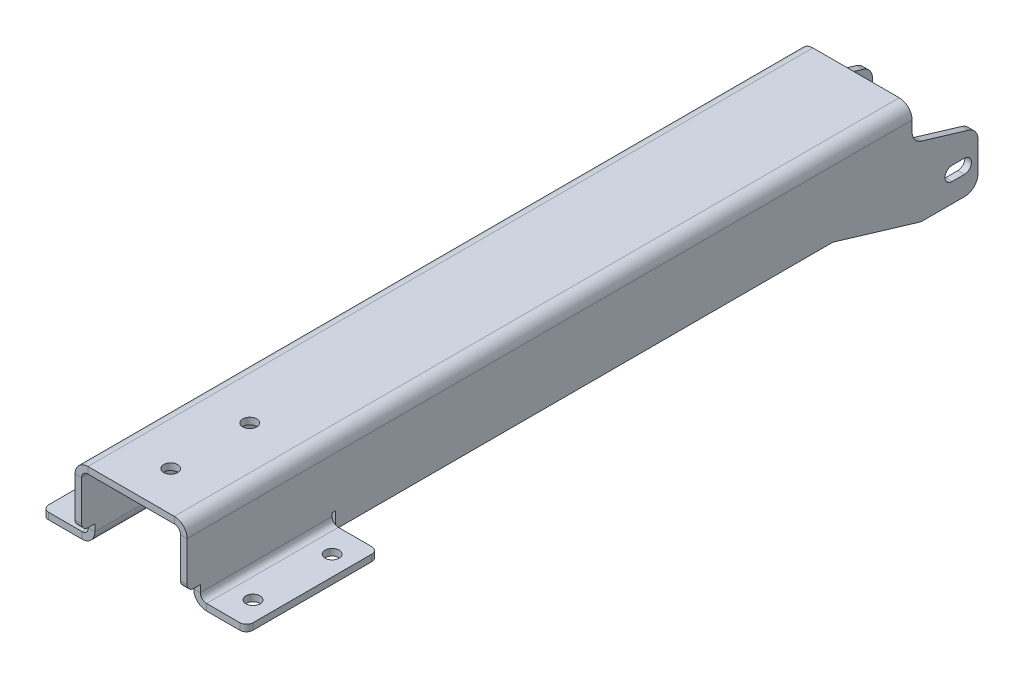
from build123d import *

# Parameters (mm, degrees)
SKETCH1_W                            = 47.625
SKETCH1_H                            = 352.425
BASE_FLANGE1_DEPTH                   = 3.175
EDGE_FLANGE1_STRIP_W                 = 18.7
EDGE_FLANGE1_STRIP_H                 = 3.175
EDGE_FLANGE1_STRIP_CUT_DEPTH         = 352.425
EDGE_FLANGE1_DEPTH                   = 352.425
EDGE_FLANGE2_STRIP_W                 = 18.7
EDGE_FLANGE2_STRIP_H                 = 3.175
EDGE_FLANGE2_STRIP_CUT_DEPTH         = 352.425
EDGE_FLANGE2_DEPTH                   = 352.425
BOSS_EXTRUDE1_DEPTH                  = 3.175
BOSS_EXTRUDE2_DEPTH                  = 3.175
F_17_64_START                        = -3.175
F_17_64_0_26563_DIAMETER_SLOT1_DEPTH = 53.975
F_17_64_0_26563_DIAMETER_HOLE2_D     = 6.747002
SKETCH21_W                           = 9.525
SKETCH21_H                           = 9.525
CUT_EXTRUDE1_DEPTH                   = 392.259979106
EDGE_FLANGE5_STRIP_W                 = 18.7
EDGE_FLANGE5_STRIP_H                 = 3.175
EDGE_FLANGE5_STRIP_CUT_DEPTH         = 63.5
EDGE_FLANGE5_RELIEF_W                = 20.2875
EDGE_FLANGE5_RELIEF_H                = 1.5875
EDGE_FLANGE5_RELIEF_CUT_DEPTH        = 3.175
EDGE_FLANGE5_DEPTH                   = 63.5
FILLET2_R                            = 6.35
F_17_64_0_26563_DIAMETER_HOLE3_D     = 6.747002
FILLET3_R                            = 3.175
CUT_EXTRUDE3_DEPTH                   = 395.939882292
CUT_EXTRUDE3_DEPTH_BACK              = 395.939882292
SKETCH30_W                           = 3.175
SKETCH30_H                           = 28.575
FILLET4_R                            = 3.175


# Read off the part's stored shape, not the designer's step: 17/64 (0.26563) Diameter Slot1
# Sheet-metal steps are written as plain solids
with BuildPart() as part:
    # Sketch1 → Base-Flange1 (new body)
    with BuildSketch(Plane(origin=(0, 0, 0), x_dir=(1, 0, 0), z_dir=(0, 1, 0))):
        with Locations((23.8125, 176.2125)):
            Rectangle(SKETCH1_W, SKETCH1_H)
    extrude(amount=-BASE_FLANGE1_DEPTH)

    # Edge-Flange1 strip (across the edge) → Edge-Flange1 strip cut (cut)
    with BuildSketch(Plane(origin=(47.625, -3.175, -352.425), x_dir=(-1, 0, 0), z_dir=(0, 0, 1))):
        with Locations((-6.35, -1.5875)):
            Rectangle(EDGE_FLANGE1_STRIP_W, EDGE_FLANGE1_STRIP_H)
    extrude(amount=EDGE_FLANGE1_STRIP_CUT_DEPTH, mode=Mode.SUBTRACT)

    # Edge-Flange1 section (across the edge) → Edge-Flange1 (add)
    with BuildSketch(Plane(origin=(47.625, -3.175, -352.425), x_dir=(-1, 0, 0), z_dir=(0, 0, 1))):
        with BuildLine():
            Line((-3.175, 3), (-3.175, 34.925))
            Line((-3.175, 34.925), (0, 34.925))
            Line((0, 34.925), (0, 3))
            ThreePointArc((0, 3), (0.878679656, 0.878679656), (3, 0))
            Line((3, 0), (3, -3.175))
            ThreePointArc((3, -3.175), (-1.366384374, -1.366384374), (-3.175, 3))
        make_face()
    extrude(amount=EDGE_FLANGE1_DEPTH)

    # Edge-Flange2 strip (across the edge) → Edge-Flange2 strip cut (cut)
    with BuildSketch(Plane(origin=(0, -3.175, 0), x_dir=(1, 0, 0), z_dir=(0, 0, -1))):
        with Locations((-6.35, -1.5875)):
            Rectangle(EDGE_FLANGE2_STRIP_W, EDGE_FLANGE2_STRIP_H)
    extrude(amount=EDGE_FLANGE2_STRIP_CUT_DEPTH, mode=Mode.SUBTRACT)

    # Edge-Flange2 section (across the edge) → Edge-Flange2 (add)
    with BuildSketch(Plane(origin=(0, -3.175, 0), x_dir=(1, 0, 0), z_dir=(0, 0, -1))):
        with BuildLine():
            Line((-3.175, 3), (-3.175, 34.925))
            Line((-3.175, 34.925), (0, 34.925))
            Line((0, 34.925), (0, 3))
            ThreePointArc((0, 3), (0.878679656, 0.878679656), (3, 0))
            Line((3, 0), (3, -3.175))
            ThreePointArc((3, -3.175), (-1.366384374, -1.366384374), (-3.175, 3))
        make_face()
    extrude(amount=EDGE_FLANGE2_DEPTH)

    # Sketch12 → Boss-Extrude1 (add)
    with BuildSketch(Plane.ZY.offset(3.175)):
        Polygon((-384.175, -50.8), (-384.175, -25.4), (-352.425, -15.875), (-352.425, -38.1), (-314.325, -38.1), (-356.658333333, -50.8), align=None)
    extrude(amount=-BOSS_EXTRUDE1_DEPTH)

    # Sketch13 → Boss-Extrude2 (add)
    with BuildSketch(Plane(origin=(50.8, 0, 0), x_dir=(0, 0, -1), z_dir=(1, 0, 0))):
        Polygon((352.425, -15.875), (352.425, -38.1), (314.325, -38.1), (356.658333333, -50.8), (384.175, -50.8), (384.175, -25.4), align=None)
    extrude(amount=-BOSS_EXTRUDE2_DEPTH)

    # 17/64 (0.26563) Diameter Slot1 outline → 17/64 (0.26563) Diameter Slot1 (cut)
    with BuildSketch(Plane.YZ.offset(F_17_64_START)):
        with BuildLine():
            ThreePointArc((-41.473501, -377.626499), (-38.1, -381), (-34.726499, -377.626499))
            Line((-34.726499, -377.626499), (-34.726499, -371.673501))
            ThreePointArc((-34.726499, -371.673501), (-38.1, -368.3), (-41.473501, -371.673501))
            Line((-41.473501, -371.673501), (-41.473501, -377.626499))
        make_face()
    extrude(amount=F_17_64_0_26563_DIAMETER_SLOT1_DEPTH, mode=Mode.SUBTRACT)

    # 17/64 (0.26563) Diameter Hole2 (through all)
    with Locations(Plane(origin=(0, 0, 0), x_dir=(1, 0, 0), z_dir=(0, 1, 0))):
        with Locations((23.8125, 22.225), (23.8125, 60.325)):
            Hole(F_17_64_0_26563_DIAMETER_HOLE2_D / 2)

    # Sketch21 → Cut-Extrude1 (cut, through all)
    with BuildSketch(Plane.ZY.offset(3.175)):
        with Locations((-4.7625, -33.3375)):
            Rectangle(SKETCH21_W, SKETCH21_H)
    extrude(amount=-CUT_EXTRUDE1_DEPTH, mode=Mode.SUBTRACT)

    # Edge-Flange5 strip (across the edge) → Edge-Flange5 strip cut (cut)
    with BuildSketch(Plane(origin=(-3.175, -38.1, -73.025), x_dir=(0, 1, 0), z_dir=(0, 0, 1))):
        with Locations((-3.175, -1.5875)):
            Rectangle(EDGE_FLANGE5_STRIP_W, EDGE_FLANGE5_STRIP_H)
    edge_flange5_strip_cut = extrude(amount=EDGE_FLANGE5_STRIP_CUT_DEPTH, mode=Mode.SUBTRACT)

    # Edge-Flange5 relief (on the sheet) → Edge-Flange5 relief cut (cut)
    with BuildSketch(Plane(origin=(-3.175, -31.925, -73.025), x_dir=(0, 1, 0), z_dir=(-1, 0, 0))):
        with Locations((-8.55625, 0.79375)):
            Rectangle(EDGE_FLANGE5_RELIEF_W, EDGE_FLANGE5_RELIEF_H)
    edge_flange5_relief_cut = extrude(amount=-EDGE_FLANGE5_RELIEF_CUT_DEPTH, mode=Mode.SUBTRACT)

    # Edge-Flange5 section (across the edge) → Edge-Flange5 (add)
    with BuildSketch(Plane(origin=(-3.175, -38.1, -73.025), x_dir=(0, 1, 0), z_dir=(0, 0, 1))):
        with BuildLine():
            Line((0, 3), (0, 22.225))
            Line((0, 22.225), (3.175, 22.225))
            Line((3.175, 22.225), (3.175, 3))
            ThreePointArc((3.175, 3), (4.053679656, 0.878679656), (6.175, 0))
            Line((6.175, 0), (6.175, -3.175))
            ThreePointArc((6.175, -3.175), (1.808615626, -1.366384374), (0, 3))
        make_face()
    edge_flange5 = extrude(amount=EDGE_FLANGE5_DEPTH)

    # Fillet2
    fillet2_edges = [part.edges().sort_by_distance(p)[0] for p in [
        (-1.5875, -38.1, -314.325),
        (-1.5875, -50.8, -356.658333333),
        (-1.5875, -50.8, -384.175),
        (-1.5875, -25.4, -384.175),
        (-1.5875, -15.875, -352.425),
        (49.2125, -38.1, -314.325),
        (49.2125, -15.875, -352.425),
        (49.2125, -25.4, -384.175),
        (49.2125, -50.8, -384.175),
        (49.2125, -50.8, -356.658333333),
    ]]
    fillet(fillet2_edges, radius=FILLET2_R)

    # Mirror1: Edge-Flange5 strip cut, Edge-Flange5 relief cut, Edge-Flange5 across plane
    add(edge_flange5_strip_cut.mirror(Plane.ZY.offset(-23.8125)), mode=Mode.SUBTRACT)
    add(edge_flange5_relief_cut.mirror(Plane.ZY.offset(-23.8125)), mode=Mode.SUBTRACT)
    add(edge_flange5.mirror(Plane.ZY.offset(-23.8125)))

    # 17/64 (0.26563) Diameter Hole3 (through all)
    with Locations(Plane(origin=(0, -34.925, 0), x_dir=(1, 0, 0), z_dir=(0, 1, 0))):
        with Locations((-15.875, 60.325), (-15.875, 22.225)):
            f_17_64_0_26563_diameter_hole3 = Hole(F_17_64_0_26563_DIAMETER_HOLE3_D / 2)

    # Mirror2: 17/64 (0.26563) Diameter Hole3 across plane
    add(f_17_64_0_26563_diameter_hole3.mirror(Plane.ZY.offset(-23.8125)), mode=Mode.SUBTRACT)

    # Fillet3
    fillet3_edges = [part.edges().sort_by_distance(p)[0] for p in [
        (-25.4, -36.5125, -73.025),
        (-25.4, -36.5125, -9.525),
        (73.025, -36.5125, -9.525),
        (73.025, -36.5125, -73.025),
    ]]
    fillet(fillet3_edges, radius=FILLET3_R)

    # Sketch30 → Cut-Extrude3 (cut, two sides: drawn at the far end of the back side and taken through both)
    with BuildSketch(Plane.ZY.offset(3.175).offset(-CUT_EXTRUDE3_DEPTH_BACK)):
        with Locations((-1.5875, -14.2875)):
            Rectangle(SKETCH30_W, SKETCH30_H)
    extrude(amount=CUT_EXTRUDE3_DEPTH + CUT_EXTRUDE3_DEPTH_BACK, mode=Mode.SUBTRACT)

    # Fillet4
    fillet4_edges = [part.edges().sort_by_distance(p)[0] for p in [
        (49.2125, -28.575, -3.175),
        (-1.5875, -28.575, -3.175),
    ]]
    fillet(fillet4_edges, radius=FILLET4_R)


solid = part.part
